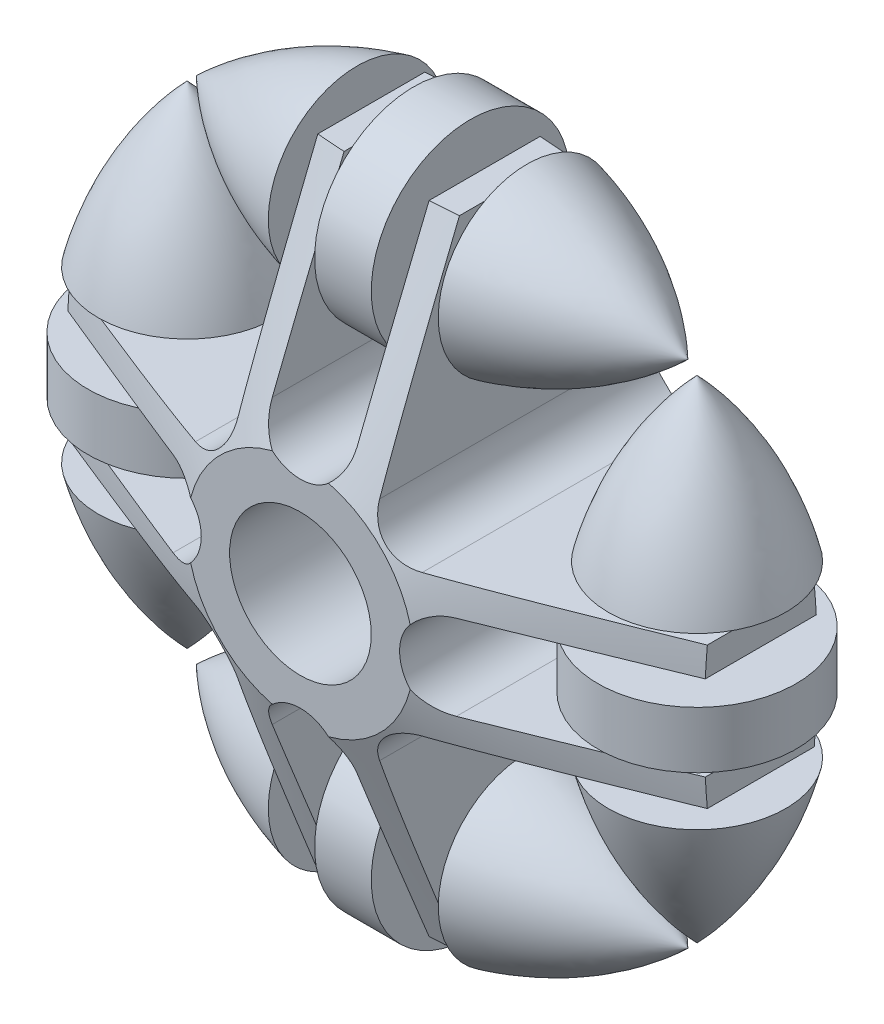
from build123d import *

# Parameters (mm, degrees)
SKETCH_1_R               = 5
EXTRUDE_1_DEPTH          = 10
SKETCH_3_R               = 7
EXTRUDE_2_DEPTH          = 2
PATTERN_CIRCULAR_1_COUNT = 4
PATTERN_CIRCULAR_3_COUNT = 4
PATTERN_CIRCULAR_4_COUNT = 4


with BuildPart() as part:
    # 草图1 → 凸台-拉伸1 (new, symmetric)
    with BuildSketch(Plane.XY):
        with BuildLine():
            Line((-5, 22.5), (-3, 22.5))
            Line((-3, 22.5), (-3, 10))
            ThreePointArc((-3, 10), (0, 7), (3, 10))
            Line((3, 10), (3, 22.5))
            Line((3, 22.5), (5, 22.5))
            Line((5, 22.5), (5, 8))
            ThreePointArc((5, 8), (5.878679656, 5.878679656), (8, 5))
            Line((8, 5), (22.5, 5))
            Line((22.5, 5), (22.5, 3))
            Line((22.5, 3), (10, 3))
            ThreePointArc((10, 3), (7, 0), (10, -3))
            Line((10, -3), (22.5, -3))
            Line((22.5, -3), (22.5, -5))
            Line((22.5, -5), (8, -5))
            ThreePointArc((8, -5), (5.878679656, -5.878679656), (5, -8))
            Line((5, -8), (5, -22.5))
            Line((5, -22.5), (3, -22.5))
            Line((3, -22.5), (3, -10))
            ThreePointArc((3, -10), (0, -7), (-3, -10))
            Line((-3, -10), (-3, -22.5))
            Line((-3, -22.5), (-5, -22.5))
            Line((-5, -22.5), (-5, -8))
            ThreePointArc((-5, -8), (-5.878679656, -5.878679656), (-8, -5))
            Line((-8, -5), (-22.5, -5))
            Line((-22.5, -5), (-22.5, -3))
            Line((-22.5, -3), (-10, -3))
            ThreePointArc((-10, -3), (-7, 0), (-10, 3))
            Line((-10, 3), (-22.5, 3))
            Line((-22.5, 3), (-22.5, 5))
            Line((-22.5, 5), (-8, 5))
            ThreePointArc((-8, 5), (-5.878679656, 5.878679656), (-5, 8))
            Line((-5, 8), (-5, 22.5))
        make_face()
        Circle(SKETCH_1_R, mode=Mode.SUBTRACT)
    extrude(amount=EXTRUDE_1_DEPTH, both=True)

    # 草图2 → 切除-旋转1 (revolve, cut)
    with BuildSketch(Plane(origin=(0, 0, 0), x_dir=(0, 0, -1), z_dir=(1, 0, 0))):
        Polygon((-10, 8), (-10, 24.367272037), (-3.227335709, 24.367272037), align=None)
        Polygon((3.227335709, 24.367272037), (10, 8), (10, 24.367272037), align=None)
    revolve(axis=Axis((0, 0, 10), (0, 0, -1)), mode=Mode.SUBTRACT)


with BuildPart() as body_2:
    # 草图3 → 凸台-拉伸2 (new, symmetric)
    with BuildSketch(Plane(origin=(0, 0, 0), x_dir=(0, 0, -1), z_dir=(1, 0, 0))):
        with Locations((0, 18)):
            Circle(SKETCH_3_R)
    extrude(amount=EXTRUDE_2_DEPTH, both=True)


with BuildPart() as pattern_circular_1_1:
    # 阵列(圆周)1: pattern copy
    add(body_2.part.rotate(Axis((0, 0, 10), (0, 0, -1)), 1 * 360 / PATTERN_CIRCULAR_1_COUNT))


with BuildPart() as pattern_circular_1_2:
    # 阵列(圆周)1: pattern copy
    add(body_2.part.rotate(Axis((0, 0, 10), (0, 0, -1)), 2 * 360 / PATTERN_CIRCULAR_1_COUNT))


with BuildPart() as pattern_circular_1_3:
    # 阵列(圆周)1: pattern copy
    add(body_2.part.rotate(Axis((0, 0, 10), (0, 0, -1)), 3 * 360 / PATTERN_CIRCULAR_1_COUNT))


with BuildPart() as body_6:
    # 草图4 → 旋转1 (revolve)
    with BuildSketch(Plane.XY):
        with BuildLine():
            Line((6, 24.269322199), (6, 18))
            Line((6, 18), (17.349351573, 18))
            ThreePointArc((17.349351573, 18), (12.088182449, 21.883232053), (6, 24.269322199))
        make_face()
    revolve(axis=Axis((2, 18, 0), (1, 0, 0)))


with BuildPart() as pattern_circular_3_1:
    # 阵列(圆周)3: pattern copy
    add(body_6.part.rotate(Axis((0, 0, 10), (0, 0, -1)), 1 * 360 / PATTERN_CIRCULAR_3_COUNT))


with BuildPart() as pattern_circular_3_2:
    # 阵列(圆周)3: pattern copy
    add(body_6.part.rotate(Axis((0, 0, 10), (0, 0, -1)), 2 * 360 / PATTERN_CIRCULAR_3_COUNT))


with BuildPart() as pattern_circular_3_3:
    # 阵列(圆周)3: pattern copy
    add(body_6.part.rotate(Axis((0, 0, 10), (0, 0, -1)), 3 * 360 / PATTERN_CIRCULAR_3_COUNT))


with BuildPart() as body_10:
    # 镜向1: mirrored copy
    add(body_6.part.mirror(Plane(origin=(0, 0, 0), x_dir=(0, 0, 1), z_dir=(1, 0, 0))))


with BuildPart() as pattern_circular_4_1:
    # 阵列(圆周)4: pattern copy
    add(body_10.part.rotate(Axis((0, 0, 10), (0, 0, -1)), 1 * 360 / PATTERN_CIRCULAR_4_COUNT))


with BuildPart() as pattern_circular_4_2:
    # 阵列(圆周)4: pattern copy
    add(body_10.part.rotate(Axis((0, 0, 10), (0, 0, -1)), 2 * 360 / PATTERN_CIRCULAR_4_COUNT))


with BuildPart() as pattern_circular_4_3:
    # 阵列(圆周)4: pattern copy
    add(body_10.part.rotate(Axis((0, 0, 10), (0, 0, -1)), 3 * 360 / PATTERN_CIRCULAR_4_COUNT))


solid = Compound([part.part, body_2.part, pattern_circular_1_1.part, pattern_circular_1_2.part, pattern_circular_1_3.part, body_6.part, pattern_circular_3_1.part, pattern_circular_3_2.part, pattern_circular_3_3.part, body_10.part, pattern_circular_4_1.part, pattern_circular_4_2.part, pattern_circular_4_3.part])
